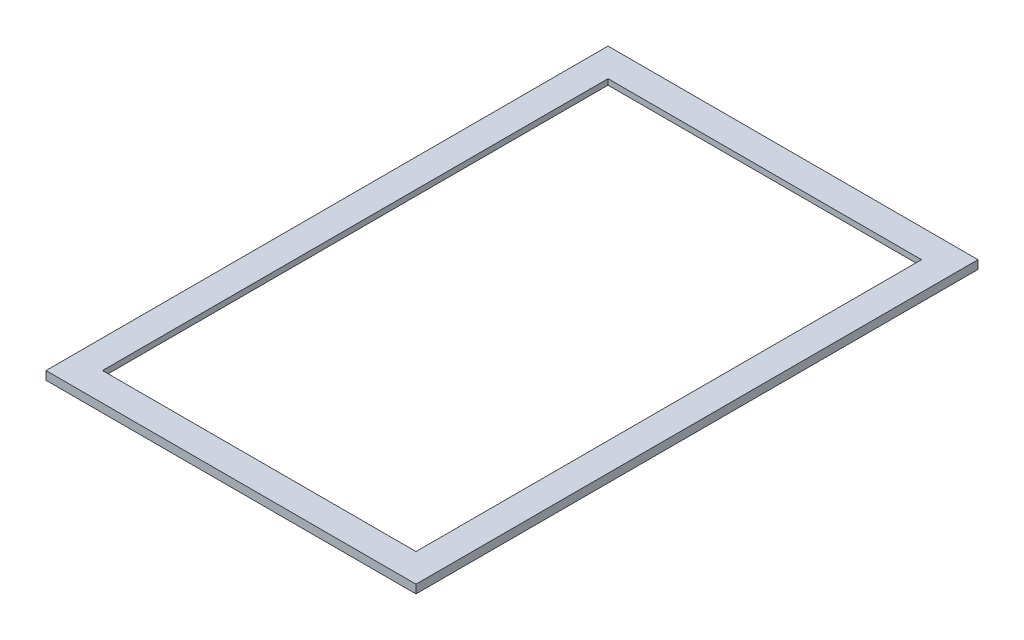
from build123d import *

# Parameters (mm, degrees)
SKETCH_1_W          = 131
SKETCH_1_H          = 199
EXTRUDE_1_DEPTH     = 3
SKETCH_2_W          = 111
SKETCH_2_H          = 179
CUT_EXTRUDE_1_DEPTH = 6
SKETCH_3_W          = 117.659063264
SKETCH_3_H          = 189
CUT_EXTRUDE_2_DEPTH = 1


with BuildPart() as part:
    # Эскиз1 → Бобышка-Вытянуть1 (new body)
    with BuildSketch(Plane(origin=(0, 0, 0), x_dir=(1, 0, 0), z_dir=(0, 1, 0))):
        Rectangle(SKETCH_1_W, SKETCH_1_H)
    extrude(amount=EXTRUDE_1_DEPTH)

    # Эскиз2 → Вырез-Вытянуть1 (cut)
    with BuildSketch(Plane(origin=(0, 3, 0), x_dir=(1, 0, 0), z_dir=(0, 1, 0))):
        Rectangle(SKETCH_2_W, SKETCH_2_H)
    extrude(amount=-CUT_EXTRUDE_1_DEPTH, mode=Mode.SUBTRACT)

    # Эскиз3 → Вырез-Вытянуть2 (cut)
    with BuildSketch(Plane.XZ):
        Rectangle(SKETCH_3_W, SKETCH_3_H)
    extrude(amount=-CUT_EXTRUDE_2_DEPTH, mode=Mode.SUBTRACT)


solid = part.part
